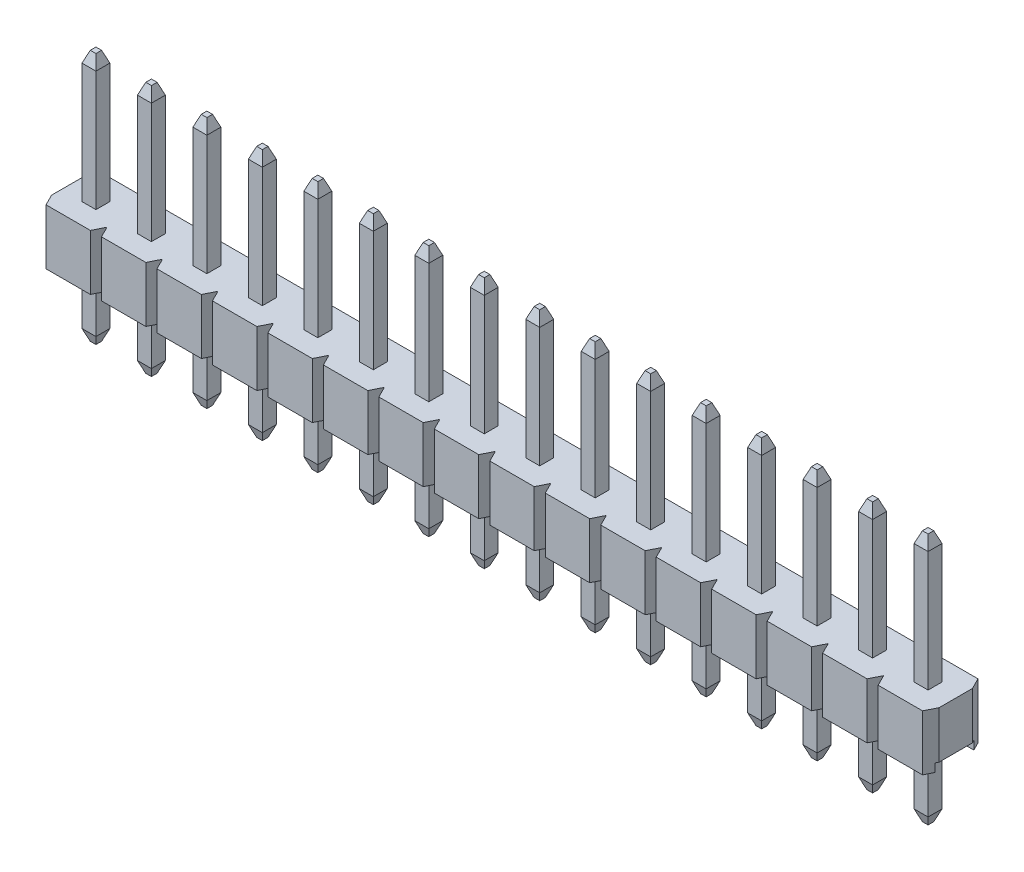
from build123d import *
from OCP.BRepFilletAPI import BRepFilletAPI_MakeChamfer

# Parameters (mm, degrees)
SKETCH1_W                     = 2.54
SKETCH1_H                     = 2.54
MAIN_BODY_DEPTH               = 2.54
SKETCH3_W                     = 1.778
SKETCH3_H                     = 0.381
CUT_EXTRUDE1_DEPTH            = 5.399409051
CUT_EXTRUDE2_DEPTH            = 5.399409051
BODY_PATTERN_COUNT            = 16
BODY_PATTERN_PITCH            = 2.54
PIN_START                     = -5.54
SKETCH2_W                     = 0.64
SKETCH2_H                     = 0.64
PIN_DEPTH                     = 11.54
CHAMFER1_SIZE                 = 0.508
CHAMFER1_SIZE2                = 0.1905
CHAMFER2_SIZE                 = 0.1905
CHAMFER2_SIZE2                = 0.508
PIN_PATTERN_COUNT             = 16
PIN_PATTERN_PITCH             = 2.54
CHAMFER1_OF_PIN_PATTERN_SIZE  = 0.508
CHAMFER1_OF_PIN_PATTERN_SIZE2 = 0.1905
CHAMFER2_OF_PIN_PATTERN_SIZE2 = 0.1905
CHAMFER2_OF_PIN_PATTERN_SIZE  = 0.508


with BuildPart() as part:
    # Sketch1 → Main Body (new body)
    with BuildSketch(Plane(origin=(0, 0, 0), x_dir=(1, 0, 0), z_dir=(0, 1, 0))):
        with Locations((1.27, 1.27)):
            Rectangle(SKETCH1_W, SKETCH1_H)
    main_body = extrude(amount=MAIN_BODY_DEPTH)

    # Sketch3 → Cut-Extrude1 (cut, through all)
    with BuildSketch(Plane.ZY):
        with Locations((-1.27, 0.1905)):
            Rectangle(SKETCH3_W, SKETCH3_H)
    cut_extrude1 = extrude(amount=-CUT_EXTRUDE1_DEPTH, mode=Mode.SUBTRACT)

    # Sketch4 → Cut-Extrude2 (cut, through all)
    with BuildSketch(Plane(origin=(0, 2.54, 0), x_dir=(1, 0, 0), z_dir=(0, 1, 0))):
        Polygon((0.254, 2.54), (0, 2.54), (0, 2.032), align=None)
        Polygon((2.54, 2.54), (2.286, 2.54), (2.54, 2.032), align=None)
        Polygon((0.254, 0), (0, 0.508), (0, 0), align=None)
        Polygon((2.54, 0), (2.286, 0), (2.54, 0.508), align=None)
    cut_extrude2 = extrude(amount=-CUT_EXTRUDE2_DEPTH, mode=Mode.SUBTRACT)

    # Body Pattern: Main Body, Cut-Extrude1, Cut-Extrude2 ×16
    with Locations(*[(-i * BODY_PATTERN_PITCH, 0, 0) for i in range(1, BODY_PATTERN_COUNT)]):
        add(main_body)
        add(cut_extrude1, mode=Mode.SUBTRACT)
        add(cut_extrude2, mode=Mode.SUBTRACT)

    # Sketch2 → Pin (add)
    with BuildSketch(Plane(origin=(0, 2.54, 0), x_dir=(1, 0, 0), z_dir=(0, 1, 0)).offset(PIN_START)):
        with Locations((1.27, 1.27)):
            Rectangle(SKETCH2_W, SKETCH2_H)
    pin = extrude(amount=PIN_DEPTH)

    # Chamfer1: one chamfer whose edges measure the first distance from different faces: ONE call of the kernel's chamfer builder (chamfer() names one face for all edges)
    chamfer1_edges_1 = [part.edges().sort_by_distance(p)[0] for p in [
        (0.95, 8.54, -1.27),
    ]]
    chamfer1_side_1 = [part.faces().sort_by_distance(p)[0] for p in [
        (0.95, 5.54, -1.27),
    ]]
    chamfer1_edges_2 = [part.edges().sort_by_distance(p)[0] for p in [
        (1.27, 8.54, -0.95),
    ]]
    chamfer1_side_2 = [part.faces().sort_by_distance(p)[0] for p in [
        (1.27, 5.54, -0.95),
    ]]
    chamfer1_edges_3 = [part.edges().sort_by_distance(p)[0] for p in [
        (1.59, 8.54, -1.27),
    ]]
    chamfer1_side_3 = [part.faces().sort_by_distance(p)[0] for p in [
        (1.59, 5.54, -1.27),
    ]]
    chamfer1_edges_4 = [part.edges().sort_by_distance(p)[0] for p in [
        (1.27, 8.54, -1.59),
    ]]
    chamfer1_side_4 = [part.faces().sort_by_distance(p)[0] for p in [
        (1.27, 5.54, -1.59),
    ]]
    chamfer1 = BRepFilletAPI_MakeChamfer(part.part.solid().wrapped)
    for e in chamfer1_edges_1:
        chamfer1.Add(CHAMFER1_SIZE, CHAMFER1_SIZE2, e.wrapped, chamfer1_side_1[0].wrapped)  # the first distance lies on this face
    for e in chamfer1_edges_2:
        chamfer1.Add(CHAMFER1_SIZE, CHAMFER1_SIZE2, e.wrapped, chamfer1_side_2[0].wrapped)  # the first distance lies on this face
    for e in chamfer1_edges_3:
        chamfer1.Add(CHAMFER1_SIZE, CHAMFER1_SIZE2, e.wrapped, chamfer1_side_3[0].wrapped)  # the first distance lies on this face
    for e in chamfer1_edges_4:
        chamfer1.Add(CHAMFER1_SIZE, CHAMFER1_SIZE2, e.wrapped, chamfer1_side_4[0].wrapped)  # the first distance lies on this face
    add(Compound.cast(chamfer1.Shape()), mode=Mode.REPLACE)

    # Chamfer2
    chamfer2_edges = [part.edges().sort_by_distance(p)[0] for p in [
        (1.27, -3, -0.95),
        (1.59, -3, -1.27),
        (1.27, -3, -1.59),
        (0.95, -3, -1.27),
    ]]
    chamfer2_side = [part.faces().sort_by_distance(p)[0] for p in [
        (1.27, -3, -1.27),
    ]]
    chamfer(chamfer2_edges, length=CHAMFER2_SIZE, length2=CHAMFER2_SIZE2, reference=chamfer2_side[0])

    # Pin Pattern: Pin ×16
    with Locations(*[(-i * PIN_PATTERN_PITCH, 0, 0) for i in range(1, PIN_PATTERN_COUNT)]):
        add(pin)

    # Chamfer1 of Pin Pattern: one chamfer whose edges measure the first distance from different faces: ONE call of the kernel's chamfer builder (chamfer() names one face for all edges)
    chamfer1_of_pin_pattern_edges_1 = [part.edges().sort_by_distance(p)[0] for p in [
        (-1.59, 8.54, -1.27),
    ]]
    chamfer1_of_pin_pattern_side_1 = [part.faces().sort_by_distance(p)[0] for p in [
        (-1.59, 5.54, -1.27),
    ]]
    chamfer1_of_pin_pattern_edges_2 = [part.edges().sort_by_distance(p)[0] for p in [
        (-1.27, 8.54, -0.95),
    ]]
    chamfer1_of_pin_pattern_side_2 = [part.faces().sort_by_distance(p)[0] for p in [
        (-1.27, 5.54, -0.95),
    ]]
    chamfer1_of_pin_pattern_edges_3 = [part.edges().sort_by_distance(p)[0] for p in [
        (-0.95, 8.54, -1.27),
    ]]
    chamfer1_of_pin_pattern_side_3 = [part.faces().sort_by_distance(p)[0] for p in [
        (-0.95, 5.54, -1.27),
    ]]
    chamfer1_of_pin_pattern_edges_4 = [part.edges().sort_by_distance(p)[0] for p in [
        (-1.27, 8.54, -1.59),
    ]]
    chamfer1_of_pin_pattern_side_4 = [part.faces().sort_by_distance(p)[0] for p in [
        (-1.27, 5.54, -1.59),
    ]]
    chamfer1_of_pin_pattern_edges_5 = [part.edges().sort_by_distance(p)[0] for p in [
        (-4.13, 8.54, -1.27),
    ]]
    chamfer1_of_pin_pattern_side_5 = [part.faces().sort_by_distance(p)[0] for p in [
        (-4.13, 5.54, -1.27),
    ]]
    chamfer1_of_pin_pattern_edges_6 = [part.edges().sort_by_distance(p)[0] for p in [
        (-3.81, 8.54, -0.95),
    ]]
    chamfer1_of_pin_pattern_side_6 = [part.faces().sort_by_distance(p)[0] for p in [
        (-3.81, 5.54, -0.95),
    ]]
    chamfer1_of_pin_pattern_edges_7 = [part.edges().sort_by_distance(p)[0] for p in [
        (-3.49, 8.54, -1.27),
    ]]
    chamfer1_of_pin_pattern_side_7 = [part.faces().sort_by_distance(p)[0] for p in [
        (-3.49, 5.54, -1.27),
    ]]
    chamfer1_of_pin_pattern_edges_8 = [part.edges().sort_by_distance(p)[0] for p in [
        (-3.81, 8.54, -1.59),
    ]]
    chamfer1_of_pin_pattern_side_8 = [part.faces().sort_by_distance(p)[0] for p in [
        (-3.81, 5.54, -1.59),
    ]]
    chamfer1_of_pin_pattern_edges_9 = [part.edges().sort_by_distance(p)[0] for p in [
        (-6.67, 8.54, -1.27),
    ]]
    chamfer1_of_pin_pattern_side_9 = [part.faces().sort_by_distance(p)[0] for p in [
        (-6.67, 5.54, -1.27),
    ]]
    chamfer1_of_pin_pattern_edges_10 = [part.edges().sort_by_distance(p)[0] for p in [
        (-6.35, 8.54, -0.95),
    ]]
    chamfer1_of_pin_pattern_side_10 = [part.faces().sort_by_distance(p)[0] for p in [
        (-6.35, 5.54, -0.95),
    ]]
    chamfer1_of_pin_pattern_edges_11 = [part.edges().sort_by_distance(p)[0] for p in [
        (-6.03, 8.54, -1.27),
    ]]
    chamfer1_of_pin_pattern_side_11 = [part.faces().sort_by_distance(p)[0] for p in [
        (-6.03, 5.54, -1.27),
    ]]
    chamfer1_of_pin_pattern_edges_12 = [part.edges().sort_by_distance(p)[0] for p in [
        (-6.35, 8.54, -1.59),
    ]]
    chamfer1_of_pin_pattern_side_12 = [part.faces().sort_by_distance(p)[0] for p in [
        (-6.35, 5.54, -1.59),
    ]]
    chamfer1_of_pin_pattern_edges_13 = [part.edges().sort_by_distance(p)[0] for p in [
        (-9.21, 8.54, -1.27),
    ]]
    chamfer1_of_pin_pattern_side_13 = [part.faces().sort_by_distance(p)[0] for p in [
        (-9.21, 5.54, -1.27),
    ]]
    chamfer1_of_pin_pattern_edges_14 = [part.edges().sort_by_distance(p)[0] for p in [
        (-8.89, 8.54, -0.95),
    ]]
    chamfer1_of_pin_pattern_side_14 = [part.faces().sort_by_distance(p)[0] for p in [
        (-8.89, 5.54, -0.95),
    ]]
    chamfer1_of_pin_pattern_edges_15 = [part.edges().sort_by_distance(p)[0] for p in [
        (-8.57, 8.54, -1.27),
    ]]
    chamfer1_of_pin_pattern_side_15 = [part.faces().sort_by_distance(p)[0] for p in [
        (-8.57, 5.54, -1.27),
    ]]
    chamfer1_of_pin_pattern_edges_16 = [part.edges().sort_by_distance(p)[0] for p in [
        (-8.89, 8.54, -1.59),
    ]]
    chamfer1_of_pin_pattern_side_16 = [part.faces().sort_by_distance(p)[0] for p in [
        (-8.89, 5.54, -1.59),
    ]]
    chamfer1_of_pin_pattern_edges_17 = [part.edges().sort_by_distance(p)[0] for p in [
        (-11.75, 8.54, -1.27),
    ]]
    chamfer1_of_pin_pattern_side_17 = [part.faces().sort_by_distance(p)[0] for p in [
        (-11.75, 5.54, -1.27),
    ]]
    chamfer1_of_pin_pattern_edges_18 = [part.edges().sort_by_distance(p)[0] for p in [
        (-11.43, 8.54, -0.95),
    ]]
    chamfer1_of_pin_pattern_side_18 = [part.faces().sort_by_distance(p)[0] for p in [
        (-11.43, 5.54, -0.95),
    ]]
    chamfer1_of_pin_pattern_edges_19 = [part.edges().sort_by_distance(p)[0] for p in [
        (-11.11, 8.54, -1.27),
    ]]
    chamfer1_of_pin_pattern_side_19 = [part.faces().sort_by_distance(p)[0] for p in [
        (-11.11, 5.54, -1.27),
    ]]
    chamfer1_of_pin_pattern_edges_20 = [part.edges().sort_by_distance(p)[0] for p in [
        (-11.43, 8.54, -1.59),
    ]]
    chamfer1_of_pin_pattern_side_20 = [part.faces().sort_by_distance(p)[0] for p in [
        (-11.43, 5.54, -1.59),
    ]]
    chamfer1_of_pin_pattern_edges_21 = [part.edges().sort_by_distance(p)[0] for p in [
        (-14.29, 8.54, -1.27),
    ]]
    chamfer1_of_pin_pattern_side_21 = [part.faces().sort_by_distance(p)[0] for p in [
        (-14.29, 5.54, -1.27),
    ]]
    chamfer1_of_pin_pattern_edges_22 = [part.edges().sort_by_distance(p)[0] for p in [
        (-13.97, 8.54, -0.95),
    ]]
    chamfer1_of_pin_pattern_side_22 = [part.faces().sort_by_distance(p)[0] for p in [
        (-13.97, 5.54, -0.95),
    ]]
    chamfer1_of_pin_pattern_edges_23 = [part.edges().sort_by_distance(p)[0] for p in [
        (-13.65, 8.54, -1.27),
    ]]
    chamfer1_of_pin_pattern_side_23 = [part.faces().sort_by_distance(p)[0] for p in [
        (-13.65, 5.54, -1.27),
    ]]
    chamfer1_of_pin_pattern_edges_24 = [part.edges().sort_by_distance(p)[0] for p in [
        (-13.97, 8.54, -1.59),
    ]]
    chamfer1_of_pin_pattern_side_24 = [part.faces().sort_by_distance(p)[0] for p in [
        (-13.97, 5.54, -1.59),
    ]]
    chamfer1_of_pin_pattern_edges_25 = [part.edges().sort_by_distance(p)[0] for p in [
        (-16.83, 8.54, -1.27),
    ]]
    chamfer1_of_pin_pattern_side_25 = [part.faces().sort_by_distance(p)[0] for p in [
        (-16.83, 5.54, -1.27),
    ]]
    chamfer1_of_pin_pattern_edges_26 = [part.edges().sort_by_distance(p)[0] for p in [
        (-16.51, 8.54, -0.95),
    ]]
    chamfer1_of_pin_pattern_side_26 = [part.faces().sort_by_distance(p)[0] for p in [
        (-16.51, 5.54, -0.95),
    ]]
    chamfer1_of_pin_pattern_edges_27 = [part.edges().sort_by_distance(p)[0] for p in [
        (-16.19, 8.54, -1.27),
    ]]
    chamfer1_of_pin_pattern_side_27 = [part.faces().sort_by_distance(p)[0] for p in [
        (-16.19, 5.54, -1.27),
    ]]
    chamfer1_of_pin_pattern_edges_28 = [part.edges().sort_by_distance(p)[0] for p in [
        (-16.51, 8.54, -1.59),
    ]]
    chamfer1_of_pin_pattern_side_28 = [part.faces().sort_by_distance(p)[0] for p in [
        (-16.51, 5.54, -1.59),
    ]]
    chamfer1_of_pin_pattern_edges_29 = [part.edges().sort_by_distance(p)[0] for p in [
        (-19.37, 8.54, -1.27),
    ]]
    chamfer1_of_pin_pattern_side_29 = [part.faces().sort_by_distance(p)[0] for p in [
        (-19.37, 5.54, -1.27),
    ]]
    chamfer1_of_pin_pattern_edges_30 = [part.edges().sort_by_distance(p)[0] for p in [
        (-19.05, 8.54, -0.95),
    ]]
    chamfer1_of_pin_pattern_side_30 = [part.faces().sort_by_distance(p)[0] for p in [
        (-19.05, 5.54, -0.95),
    ]]
    chamfer1_of_pin_pattern_edges_31 = [part.edges().sort_by_distance(p)[0] for p in [
        (-18.73, 8.54, -1.27),
    ]]
    chamfer1_of_pin_pattern_side_31 = [part.faces().sort_by_distance(p)[0] for p in [
        (-18.73, 5.54, -1.27),
    ]]
    chamfer1_of_pin_pattern_edges_32 = [part.edges().sort_by_distance(p)[0] for p in [
        (-19.05, 8.54, -1.59),
    ]]
    chamfer1_of_pin_pattern_side_32 = [part.faces().sort_by_distance(p)[0] for p in [
        (-19.05, 5.54, -1.59),
    ]]
    chamfer1_of_pin_pattern_edges_33 = [part.edges().sort_by_distance(p)[0] for p in [
        (-21.91, 8.54, -1.27),
    ]]
    chamfer1_of_pin_pattern_side_33 = [part.faces().sort_by_distance(p)[0] for p in [
        (-21.91, 5.54, -1.27),
    ]]
    chamfer1_of_pin_pattern_edges_34 = [part.edges().sort_by_distance(p)[0] for p in [
        (-21.59, 8.54, -0.95),
    ]]
    chamfer1_of_pin_pattern_side_34 = [part.faces().sort_by_distance(p)[0] for p in [
        (-21.59, 5.54, -0.95),
    ]]
    chamfer1_of_pin_pattern_edges_35 = [part.edges().sort_by_distance(p)[0] for p in [
        (-21.27, 8.54, -1.27),
    ]]
    chamfer1_of_pin_pattern_side_35 = [part.faces().sort_by_distance(p)[0] for p in [
        (-21.27, 5.54, -1.27),
    ]]
    chamfer1_of_pin_pattern_edges_36 = [part.edges().sort_by_distance(p)[0] for p in [
        (-21.59, 8.54, -1.59),
    ]]
    chamfer1_of_pin_pattern_side_36 = [part.faces().sort_by_distance(p)[0] for p in [
        (-21.59, 5.54, -1.59),
    ]]
    chamfer1_of_pin_pattern_edges_37 = [part.edges().sort_by_distance(p)[0] for p in [
        (-24.45, 8.54, -1.27),
    ]]
    chamfer1_of_pin_pattern_side_37 = [part.faces().sort_by_distance(p)[0] for p in [
        (-24.45, 5.54, -1.27),
    ]]
    chamfer1_of_pin_pattern_edges_38 = [part.edges().sort_by_distance(p)[0] for p in [
        (-24.13, 8.54, -0.95),
    ]]
    chamfer1_of_pin_pattern_side_38 = [part.faces().sort_by_distance(p)[0] for p in [
        (-24.13, 5.54, -0.95),
    ]]
    chamfer1_of_pin_pattern_edges_39 = [part.edges().sort_by_distance(p)[0] for p in [
        (-23.81, 8.54, -1.27),
    ]]
    chamfer1_of_pin_pattern_side_39 = [part.faces().sort_by_distance(p)[0] for p in [
        (-23.81, 5.54, -1.27),
    ]]
    chamfer1_of_pin_pattern_edges_40 = [part.edges().sort_by_distance(p)[0] for p in [
        (-24.13, 8.54, -1.59),
    ]]
    chamfer1_of_pin_pattern_side_40 = [part.faces().sort_by_distance(p)[0] for p in [
        (-24.13, 5.54, -1.59),
    ]]
    chamfer1_of_pin_pattern_edges_41 = [part.edges().sort_by_distance(p)[0] for p in [
        (-26.99, 8.54, -1.27),
    ]]
    chamfer1_of_pin_pattern_side_41 = [part.faces().sort_by_distance(p)[0] for p in [
        (-26.99, 5.54, -1.27),
    ]]
    chamfer1_of_pin_pattern_edges_42 = [part.edges().sort_by_distance(p)[0] for p in [
        (-26.67, 8.54, -0.95),
    ]]
    chamfer1_of_pin_pattern_side_42 = [part.faces().sort_by_distance(p)[0] for p in [
        (-26.67, 5.54, -0.95),
    ]]
    chamfer1_of_pin_pattern_edges_43 = [part.edges().sort_by_distance(p)[0] for p in [
        (-26.35, 8.54, -1.27),
    ]]
    chamfer1_of_pin_pattern_side_43 = [part.faces().sort_by_distance(p)[0] for p in [
        (-26.35, 5.54, -1.27),
    ]]
    chamfer1_of_pin_pattern_edges_44 = [part.edges().sort_by_distance(p)[0] for p in [
        (-26.67, 8.54, -1.59),
    ]]
    chamfer1_of_pin_pattern_side_44 = [part.faces().sort_by_distance(p)[0] for p in [
        (-26.67, 5.54, -1.59),
    ]]
    chamfer1_of_pin_pattern_edges_45 = [part.edges().sort_by_distance(p)[0] for p in [
        (-29.53, 8.54, -1.27),
    ]]
    chamfer1_of_pin_pattern_side_45 = [part.faces().sort_by_distance(p)[0] for p in [
        (-29.53, 5.54, -1.27),
    ]]
    chamfer1_of_pin_pattern_edges_46 = [part.edges().sort_by_distance(p)[0] for p in [
        (-29.21, 8.54, -0.95),
    ]]
    chamfer1_of_pin_pattern_side_46 = [part.faces().sort_by_distance(p)[0] for p in [
        (-29.21, 5.54, -0.95),
    ]]
    chamfer1_of_pin_pattern_edges_47 = [part.edges().sort_by_distance(p)[0] for p in [
        (-28.89, 8.54, -1.27),
    ]]
    chamfer1_of_pin_pattern_side_47 = [part.faces().sort_by_distance(p)[0] for p in [
        (-28.89, 5.54, -1.27),
    ]]
    chamfer1_of_pin_pattern_edges_48 = [part.edges().sort_by_distance(p)[0] for p in [
        (-29.21, 8.54, -1.59),
    ]]
    chamfer1_of_pin_pattern_side_48 = [part.faces().sort_by_distance(p)[0] for p in [
        (-29.21, 5.54, -1.59),
    ]]
    chamfer1_of_pin_pattern_edges_49 = [part.edges().sort_by_distance(p)[0] for p in [
        (-32.07, 8.54, -1.27),
    ]]
    chamfer1_of_pin_pattern_side_49 = [part.faces().sort_by_distance(p)[0] for p in [
        (-32.07, 5.54, -1.27),
    ]]
    chamfer1_of_pin_pattern_edges_50 = [part.edges().sort_by_distance(p)[0] for p in [
        (-31.75, 8.54, -0.95),
    ]]
    chamfer1_of_pin_pattern_side_50 = [part.faces().sort_by_distance(p)[0] for p in [
        (-31.75, 5.54, -0.95),
    ]]
    chamfer1_of_pin_pattern_edges_51 = [part.edges().sort_by_distance(p)[0] for p in [
        (-31.43, 8.54, -1.27),
    ]]
    chamfer1_of_pin_pattern_side_51 = [part.faces().sort_by_distance(p)[0] for p in [
        (-31.43, 5.54, -1.27),
    ]]
    chamfer1_of_pin_pattern_edges_52 = [part.edges().sort_by_distance(p)[0] for p in [
        (-31.75, 8.54, -1.59),
    ]]
    chamfer1_of_pin_pattern_side_52 = [part.faces().sort_by_distance(p)[0] for p in [
        (-31.75, 5.54, -1.59),
    ]]
    chamfer1_of_pin_pattern_edges_53 = [part.edges().sort_by_distance(p)[0] for p in [
        (-34.61, 8.54, -1.27),
    ]]
    chamfer1_of_pin_pattern_side_53 = [part.faces().sort_by_distance(p)[0] for p in [
        (-34.61, 5.54, -1.27),
    ]]
    chamfer1_of_pin_pattern_edges_54 = [part.edges().sort_by_distance(p)[0] for p in [
        (-34.29, 8.54, -0.95),
    ]]
    chamfer1_of_pin_pattern_side_54 = [part.faces().sort_by_distance(p)[0] for p in [
        (-34.29, 5.54, -0.95),
    ]]
    chamfer1_of_pin_pattern_edges_55 = [part.edges().sort_by_distance(p)[0] for p in [
        (-33.97, 8.54, -1.27),
    ]]
    chamfer1_of_pin_pattern_side_55 = [part.faces().sort_by_distance(p)[0] for p in [
        (-33.97, 5.54, -1.27),
    ]]
    chamfer1_of_pin_pattern_edges_56 = [part.edges().sort_by_distance(p)[0] for p in [
        (-34.29, 8.54, -1.59),
    ]]
    chamfer1_of_pin_pattern_side_56 = [part.faces().sort_by_distance(p)[0] for p in [
        (-34.29, 5.54, -1.59),
    ]]
    chamfer1_of_pin_pattern_edges_57 = [part.edges().sort_by_distance(p)[0] for p in [
        (-37.15, 8.54, -1.27),
    ]]
    chamfer1_of_pin_pattern_side_57 = [part.faces().sort_by_distance(p)[0] for p in [
        (-37.15, 5.54, -1.27),
    ]]
    chamfer1_of_pin_pattern_edges_58 = [part.edges().sort_by_distance(p)[0] for p in [
        (-36.83, 8.54, -0.95),
    ]]
    chamfer1_of_pin_pattern_side_58 = [part.faces().sort_by_distance(p)[0] for p in [
        (-36.83, 5.54, -0.95),
    ]]
    chamfer1_of_pin_pattern_edges_59 = [part.edges().sort_by_distance(p)[0] for p in [
        (-36.51, 8.54, -1.27),
    ]]
    chamfer1_of_pin_pattern_side_59 = [part.faces().sort_by_distance(p)[0] for p in [
        (-36.51, 5.54, -1.27),
    ]]
    chamfer1_of_pin_pattern_edges_60 = [part.edges().sort_by_distance(p)[0] for p in [
        (-36.83, 8.54, -1.59),
    ]]
    chamfer1_of_pin_pattern_side_60 = [part.faces().sort_by_distance(p)[0] for p in [
        (-36.83, 5.54, -1.59),
    ]]
    chamfer1_of_pin_pattern = BRepFilletAPI_MakeChamfer(part.part.solid().wrapped)
    for e in chamfer1_of_pin_pattern_edges_1:
        chamfer1_of_pin_pattern.Add(CHAMFER1_OF_PIN_PATTERN_SIZE, CHAMFER1_OF_PIN_PATTERN_SIZE2, e.wrapped, chamfer1_of_pin_pattern_side_1[0].wrapped)  # the first distance lies on this face
    for e in chamfer1_of_pin_pattern_edges_2:
        chamfer1_of_pin_pattern.Add(CHAMFER1_OF_PIN_PATTERN_SIZE, CHAMFER1_OF_PIN_PATTERN_SIZE2, e.wrapped, chamfer1_of_pin_pattern_side_2[0].wrapped)  # the first distance lies on this face
    for e in chamfer1_of_pin_pattern_edges_3:
        chamfer1_of_pin_pattern.Add(CHAMFER1_OF_PIN_PATTERN_SIZE, CHAMFER1_OF_PIN_PATTERN_SIZE2, e.wrapped, chamfer1_of_pin_pattern_side_3[0].wrapped)  # the first distance lies on this face
    for e in chamfer1_of_pin_pattern_edges_4:
        chamfer1_of_pin_pattern.Add(CHAMFER1_OF_PIN_PATTERN_SIZE, CHAMFER1_OF_PIN_PATTERN_SIZE2, e.wrapped, chamfer1_of_pin_pattern_side_4[0].wrapped)  # the first distance lies on this face
    for e in chamfer1_of_pin_pattern_edges_5:
        chamfer1_of_pin_pattern.Add(CHAMFER1_OF_PIN_PATTERN_SIZE, CHAMFER1_OF_PIN_PATTERN_SIZE2, e.wrapped, chamfer1_of_pin_pattern_side_5[0].wrapped)  # the first distance lies on this face
    for e in chamfer1_of_pin_pattern_edges_6:
        chamfer1_of_pin_pattern.Add(CHAMFER1_OF_PIN_PATTERN_SIZE, CHAMFER1_OF_PIN_PATTERN_SIZE2, e.wrapped, chamfer1_of_pin_pattern_side_6[0].wrapped)  # the first distance lies on this face
    for e in chamfer1_of_pin_pattern_edges_7:
        chamfer1_of_pin_pattern.Add(CHAMFER1_OF_PIN_PATTERN_SIZE, CHAMFER1_OF_PIN_PATTERN_SIZE2, e.wrapped, chamfer1_of_pin_pattern_side_7[0].wrapped)  # the first distance lies on this face
    for e in chamfer1_of_pin_pattern_edges_8:
        chamfer1_of_pin_pattern.Add(CHAMFER1_OF_PIN_PATTERN_SIZE, CHAMFER1_OF_PIN_PATTERN_SIZE2, e.wrapped, chamfer1_of_pin_pattern_side_8[0].wrapped)  # the first distance lies on this face
    for e in chamfer1_of_pin_pattern_edges_9:
        chamfer1_of_pin_pattern.Add(CHAMFER1_OF_PIN_PATTERN_SIZE, CHAMFER1_OF_PIN_PATTERN_SIZE2, e.wrapped, chamfer1_of_pin_pattern_side_9[0].wrapped)  # the first distance lies on this face
    for e in chamfer1_of_pin_pattern_edges_10:
        chamfer1_of_pin_pattern.Add(CHAMFER1_OF_PIN_PATTERN_SIZE, CHAMFER1_OF_PIN_PATTERN_SIZE2, e.wrapped, chamfer1_of_pin_pattern_side_10[0].wrapped)  # the first distance lies on this face
    for e in chamfer1_of_pin_pattern_edges_11:
        chamfer1_of_pin_pattern.Add(CHAMFER1_OF_PIN_PATTERN_SIZE, CHAMFER1_OF_PIN_PATTERN_SIZE2, e.wrapped, chamfer1_of_pin_pattern_side_11[0].wrapped)  # the first distance lies on this face
    for e in chamfer1_of_pin_pattern_edges_12:
        chamfer1_of_pin_pattern.Add(CHAMFER1_OF_PIN_PATTERN_SIZE, CHAMFER1_OF_PIN_PATTERN_SIZE2, e.wrapped, chamfer1_of_pin_pattern_side_12[0].wrapped)  # the first distance lies on this face
    for e in chamfer1_of_pin_pattern_edges_13:
        chamfer1_of_pin_pattern.Add(CHAMFER1_OF_PIN_PATTERN_SIZE, CHAMFER1_OF_PIN_PATTERN_SIZE2, e.wrapped, chamfer1_of_pin_pattern_side_13[0].wrapped)  # the first distance lies on this face
    for e in chamfer1_of_pin_pattern_edges_14:
        chamfer1_of_pin_pattern.Add(CHAMFER1_OF_PIN_PATTERN_SIZE, CHAMFER1_OF_PIN_PATTERN_SIZE2, e.wrapped, chamfer1_of_pin_pattern_side_14[0].wrapped)  # the first distance lies on this face
    for e in chamfer1_of_pin_pattern_edges_15:
        chamfer1_of_pin_pattern.Add(CHAMFER1_OF_PIN_PATTERN_SIZE, CHAMFER1_OF_PIN_PATTERN_SIZE2, e.wrapped, chamfer1_of_pin_pattern_side_15[0].wrapped)  # the first distance lies on this face
    for e in chamfer1_of_pin_pattern_edges_16:
        chamfer1_of_pin_pattern.Add(CHAMFER1_OF_PIN_PATTERN_SIZE, CHAMFER1_OF_PIN_PATTERN_SIZE2, e.wrapped, chamfer1_of_pin_pattern_side_16[0].wrapped)  # the first distance lies on this face
    for e in chamfer1_of_pin_pattern_edges_17:
        chamfer1_of_pin_pattern.Add(CHAMFER1_OF_PIN_PATTERN_SIZE, CHAMFER1_OF_PIN_PATTERN_SIZE2, e.wrapped, chamfer1_of_pin_pattern_side_17[0].wrapped)  # the first distance lies on this face
    for e in chamfer1_of_pin_pattern_edges_18:
        chamfer1_of_pin_pattern.Add(CHAMFER1_OF_PIN_PATTERN_SIZE, CHAMFER1_OF_PIN_PATTERN_SIZE2, e.wrapped, chamfer1_of_pin_pattern_side_18[0].wrapped)  # the first distance lies on this face
    for e in chamfer1_of_pin_pattern_edges_19:
        chamfer1_of_pin_pattern.Add(CHAMFER1_OF_PIN_PATTERN_SIZE, CHAMFER1_OF_PIN_PATTERN_SIZE2, e.wrapped, chamfer1_of_pin_pattern_side_19[0].wrapped)  # the first distance lies on this face
    for e in chamfer1_of_pin_pattern_edges_20:
        chamfer1_of_pin_pattern.Add(CHAMFER1_OF_PIN_PATTERN_SIZE, CHAMFER1_OF_PIN_PATTERN_SIZE2, e.wrapped, chamfer1_of_pin_pattern_side_20[0].wrapped)  # the first distance lies on this face
    for e in chamfer1_of_pin_pattern_edges_21:
        chamfer1_of_pin_pattern.Add(CHAMFER1_OF_PIN_PATTERN_SIZE, CHAMFER1_OF_PIN_PATTERN_SIZE2, e.wrapped, chamfer1_of_pin_pattern_side_21[0].wrapped)  # the first distance lies on this face
    for e in chamfer1_of_pin_pattern_edges_22:
        chamfer1_of_pin_pattern.Add(CHAMFER1_OF_PIN_PATTERN_SIZE, CHAMFER1_OF_PIN_PATTERN_SIZE2, e.wrapped, chamfer1_of_pin_pattern_side_22[0].wrapped)  # the first distance lies on this face
    for e in chamfer1_of_pin_pattern_edges_23:
        chamfer1_of_pin_pattern.Add(CHAMFER1_OF_PIN_PATTERN_SIZE, CHAMFER1_OF_PIN_PATTERN_SIZE2, e.wrapped, chamfer1_of_pin_pattern_side_23[0].wrapped)  # the first distance lies on this face
    for e in chamfer1_of_pin_pattern_edges_24:
        chamfer1_of_pin_pattern.Add(CHAMFER1_OF_PIN_PATTERN_SIZE, CHAMFER1_OF_PIN_PATTERN_SIZE2, e.wrapped, chamfer1_of_pin_pattern_side_24[0].wrapped)  # the first distance lies on this face
    for e in chamfer1_of_pin_pattern_edges_25:
        chamfer1_of_pin_pattern.Add(CHAMFER1_OF_PIN_PATTERN_SIZE, CHAMFER1_OF_PIN_PATTERN_SIZE2, e.wrapped, chamfer1_of_pin_pattern_side_25[0].wrapped)  # the first distance lies on this face
    for e in chamfer1_of_pin_pattern_edges_26:
        chamfer1_of_pin_pattern.Add(CHAMFER1_OF_PIN_PATTERN_SIZE, CHAMFER1_OF_PIN_PATTERN_SIZE2, e.wrapped, chamfer1_of_pin_pattern_side_26[0].wrapped)  # the first distance lies on this face
    for e in chamfer1_of_pin_pattern_edges_27:
        chamfer1_of_pin_pattern.Add(CHAMFER1_OF_PIN_PATTERN_SIZE, CHAMFER1_OF_PIN_PATTERN_SIZE2, e.wrapped, chamfer1_of_pin_pattern_side_27[0].wrapped)  # the first distance lies on this face
    for e in chamfer1_of_pin_pattern_edges_28:
        chamfer1_of_pin_pattern.Add(CHAMFER1_OF_PIN_PATTERN_SIZE, CHAMFER1_OF_PIN_PATTERN_SIZE2, e.wrapped, chamfer1_of_pin_pattern_side_28[0].wrapped)  # the first distance lies on this face
    for e in chamfer1_of_pin_pattern_edges_29:
        chamfer1_of_pin_pattern.Add(CHAMFER1_OF_PIN_PATTERN_SIZE, CHAMFER1_OF_PIN_PATTERN_SIZE2, e.wrapped, chamfer1_of_pin_pattern_side_29[0].wrapped)  # the first distance lies on this face
    for e in chamfer1_of_pin_pattern_edges_30:
        chamfer1_of_pin_pattern.Add(CHAMFER1_OF_PIN_PATTERN_SIZE, CHAMFER1_OF_PIN_PATTERN_SIZE2, e.wrapped, chamfer1_of_pin_pattern_side_30[0].wrapped)  # the first distance lies on this face
    for e in chamfer1_of_pin_pattern_edges_31:
        chamfer1_of_pin_pattern.Add(CHAMFER1_OF_PIN_PATTERN_SIZE, CHAMFER1_OF_PIN_PATTERN_SIZE2, e.wrapped, chamfer1_of_pin_pattern_side_31[0].wrapped)  # the first distance lies on this face
    for e in chamfer1_of_pin_pattern_edges_32:
        chamfer1_of_pin_pattern.Add(CHAMFER1_OF_PIN_PATTERN_SIZE, CHAMFER1_OF_PIN_PATTERN_SIZE2, e.wrapped, chamfer1_of_pin_pattern_side_32[0].wrapped)  # the first distance lies on this face
    for e in chamfer1_of_pin_pattern_edges_33:
        chamfer1_of_pin_pattern.Add(CHAMFER1_OF_PIN_PATTERN_SIZE, CHAMFER1_OF_PIN_PATTERN_SIZE2, e.wrapped, chamfer1_of_pin_pattern_side_33[0].wrapped)  # the first distance lies on this face
    for e in chamfer1_of_pin_pattern_edges_34:
        chamfer1_of_pin_pattern.Add(CHAMFER1_OF_PIN_PATTERN_SIZE, CHAMFER1_OF_PIN_PATTERN_SIZE2, e.wrapped, chamfer1_of_pin_pattern_side_34[0].wrapped)  # the first distance lies on this face
    for e in chamfer1_of_pin_pattern_edges_35:
        chamfer1_of_pin_pattern.Add(CHAMFER1_OF_PIN_PATTERN_SIZE, CHAMFER1_OF_PIN_PATTERN_SIZE2, e.wrapped, chamfer1_of_pin_pattern_side_35[0].wrapped)  # the first distance lies on this face
    for e in chamfer1_of_pin_pattern_edges_36:
        chamfer1_of_pin_pattern.Add(CHAMFER1_OF_PIN_PATTERN_SIZE, CHAMFER1_OF_PIN_PATTERN_SIZE2, e.wrapped, chamfer1_of_pin_pattern_side_36[0].wrapped)  # the first distance lies on this face
    for e in chamfer1_of_pin_pattern_edges_37:
        chamfer1_of_pin_pattern.Add(CHAMFER1_OF_PIN_PATTERN_SIZE, CHAMFER1_OF_PIN_PATTERN_SIZE2, e.wrapped, chamfer1_of_pin_pattern_side_37[0].wrapped)  # the first distance lies on this face
    for e in chamfer1_of_pin_pattern_edges_38:
        chamfer1_of_pin_pattern.Add(CHAMFER1_OF_PIN_PATTERN_SIZE, CHAMFER1_OF_PIN_PATTERN_SIZE2, e.wrapped, chamfer1_of_pin_pattern_side_38[0].wrapped)  # the first distance lies on this face
    for e in chamfer1_of_pin_pattern_edges_39:
        chamfer1_of_pin_pattern.Add(CHAMFER1_OF_PIN_PATTERN_SIZE, CHAMFER1_OF_PIN_PATTERN_SIZE2, e.wrapped, chamfer1_of_pin_pattern_side_39[0].wrapped)  # the first distance lies on this face
    for e in chamfer1_of_pin_pattern_edges_40:
        chamfer1_of_pin_pattern.Add(CHAMFER1_OF_PIN_PATTERN_SIZE, CHAMFER1_OF_PIN_PATTERN_SIZE2, e.wrapped, chamfer1_of_pin_pattern_side_40[0].wrapped)  # the first distance lies on this face
    for e in chamfer1_of_pin_pattern_edges_41:
        chamfer1_of_pin_pattern.Add(CHAMFER1_OF_PIN_PATTERN_SIZE, CHAMFER1_OF_PIN_PATTERN_SIZE2, e.wrapped, chamfer1_of_pin_pattern_side_41[0].wrapped)  # the first distance lies on this face
    for e in chamfer1_of_pin_pattern_edges_42:
        chamfer1_of_pin_pattern.Add(CHAMFER1_OF_PIN_PATTERN_SIZE, CHAMFER1_OF_PIN_PATTERN_SIZE2, e.wrapped, chamfer1_of_pin_pattern_side_42[0].wrapped)  # the first distance lies on this face
    for e in chamfer1_of_pin_pattern_edges_43:
        chamfer1_of_pin_pattern.Add(CHAMFER1_OF_PIN_PATTERN_SIZE, CHAMFER1_OF_PIN_PATTERN_SIZE2, e.wrapped, chamfer1_of_pin_pattern_side_43[0].wrapped)  # the first distance lies on this face
    for e in chamfer1_of_pin_pattern_edges_44:
        chamfer1_of_pin_pattern.Add(CHAMFER1_OF_PIN_PATTERN_SIZE, CHAMFER1_OF_PIN_PATTERN_SIZE2, e.wrapped, chamfer1_of_pin_pattern_side_44[0].wrapped)  # the first distance lies on this face
    for e in chamfer1_of_pin_pattern_edges_45:
        chamfer1_of_pin_pattern.Add(CHAMFER1_OF_PIN_PATTERN_SIZE, CHAMFER1_OF_PIN_PATTERN_SIZE2, e.wrapped, chamfer1_of_pin_pattern_side_45[0].wrapped)  # the first distance lies on this face
    for e in chamfer1_of_pin_pattern_edges_46:
        chamfer1_of_pin_pattern.Add(CHAMFER1_OF_PIN_PATTERN_SIZE, CHAMFER1_OF_PIN_PATTERN_SIZE2, e.wrapped, chamfer1_of_pin_pattern_side_46[0].wrapped)  # the first distance lies on this face
    for e in chamfer1_of_pin_pattern_edges_47:
        chamfer1_of_pin_pattern.Add(CHAMFER1_OF_PIN_PATTERN_SIZE, CHAMFER1_OF_PIN_PATTERN_SIZE2, e.wrapped, chamfer1_of_pin_pattern_side_47[0].wrapped)  # the first distance lies on this face
    for e in chamfer1_of_pin_pattern_edges_48:
        chamfer1_of_pin_pattern.Add(CHAMFER1_OF_PIN_PATTERN_SIZE, CHAMFER1_OF_PIN_PATTERN_SIZE2, e.wrapped, chamfer1_of_pin_pattern_side_48[0].wrapped)  # the first distance lies on this face
    for e in chamfer1_of_pin_pattern_edges_49:
        chamfer1_of_pin_pattern.Add(CHAMFER1_OF_PIN_PATTERN_SIZE, CHAMFER1_OF_PIN_PATTERN_SIZE2, e.wrapped, chamfer1_of_pin_pattern_side_49[0].wrapped)  # the first distance lies on this face
    for e in chamfer1_of_pin_pattern_edges_50:
        chamfer1_of_pin_pattern.Add(CHAMFER1_OF_PIN_PATTERN_SIZE, CHAMFER1_OF_PIN_PATTERN_SIZE2, e.wrapped, chamfer1_of_pin_pattern_side_50[0].wrapped)  # the first distance lies on this face
    for e in chamfer1_of_pin_pattern_edges_51:
        chamfer1_of_pin_pattern.Add(CHAMFER1_OF_PIN_PATTERN_SIZE, CHAMFER1_OF_PIN_PATTERN_SIZE2, e.wrapped, chamfer1_of_pin_pattern_side_51[0].wrapped)  # the first distance lies on this face
    for e in chamfer1_of_pin_pattern_edges_52:
        chamfer1_of_pin_pattern.Add(CHAMFER1_OF_PIN_PATTERN_SIZE, CHAMFER1_OF_PIN_PATTERN_SIZE2, e.wrapped, chamfer1_of_pin_pattern_side_52[0].wrapped)  # the first distance lies on this face
    for e in chamfer1_of_pin_pattern_edges_53:
        chamfer1_of_pin_pattern.Add(CHAMFER1_OF_PIN_PATTERN_SIZE, CHAMFER1_OF_PIN_PATTERN_SIZE2, e.wrapped, chamfer1_of_pin_pattern_side_53[0].wrapped)  # the first distance lies on this face
    for e in chamfer1_of_pin_pattern_edges_54:
        chamfer1_of_pin_pattern.Add(CHAMFER1_OF_PIN_PATTERN_SIZE, CHAMFER1_OF_PIN_PATTERN_SIZE2, e.wrapped, chamfer1_of_pin_pattern_side_54[0].wrapped)  # the first distance lies on this face
    for e in chamfer1_of_pin_pattern_edges_55:
        chamfer1_of_pin_pattern.Add(CHAMFER1_OF_PIN_PATTERN_SIZE, CHAMFER1_OF_PIN_PATTERN_SIZE2, e.wrapped, chamfer1_of_pin_pattern_side_55[0].wrapped)  # the first distance lies on this face
    for e in chamfer1_of_pin_pattern_edges_56:
        chamfer1_of_pin_pattern.Add(CHAMFER1_OF_PIN_PATTERN_SIZE, CHAMFER1_OF_PIN_PATTERN_SIZE2, e.wrapped, chamfer1_of_pin_pattern_side_56[0].wrapped)  # the first distance lies on this face
    for e in chamfer1_of_pin_pattern_edges_57:
        chamfer1_of_pin_pattern.Add(CHAMFER1_OF_PIN_PATTERN_SIZE, CHAMFER1_OF_PIN_PATTERN_SIZE2, e.wrapped, chamfer1_of_pin_pattern_side_57[0].wrapped)  # the first distance lies on this face
    for e in chamfer1_of_pin_pattern_edges_58:
        chamfer1_of_pin_pattern.Add(CHAMFER1_OF_PIN_PATTERN_SIZE, CHAMFER1_OF_PIN_PATTERN_SIZE2, e.wrapped, chamfer1_of_pin_pattern_side_58[0].wrapped)  # the first distance lies on this face
    for e in chamfer1_of_pin_pattern_edges_59:
        chamfer1_of_pin_pattern.Add(CHAMFER1_OF_PIN_PATTERN_SIZE, CHAMFER1_OF_PIN_PATTERN_SIZE2, e.wrapped, chamfer1_of_pin_pattern_side_59[0].wrapped)  # the first distance lies on this face
    for e in chamfer1_of_pin_pattern_edges_60:
        chamfer1_of_pin_pattern.Add(CHAMFER1_OF_PIN_PATTERN_SIZE, CHAMFER1_OF_PIN_PATTERN_SIZE2, e.wrapped, chamfer1_of_pin_pattern_side_60[0].wrapped)  # the first distance lies on this face
    add(Compound.cast(chamfer1_of_pin_pattern.Shape()), mode=Mode.REPLACE)

    # Chamfer2 of Pin Pattern
    chamfer2_of_pin_pattern_edges = [part.edges().sort_by_distance(p)[0] for p in [
        (-1.27, -3, -0.95),
        (-0.95, -3, -1.27),
        (-1.27, -3, -1.59),
        (-1.59, -3, -1.27),
        (-3.81, -3, -0.95),
        (-3.49, -3, -1.27),
        (-3.81, -3, -1.59),
        (-4.13, -3, -1.27),
        (-6.35, -3, -0.95),
        (-6.03, -3, -1.27),
        (-6.35, -3, -1.59),
        (-6.67, -3, -1.27),
        (-8.89, -3, -0.95),
        (-8.57, -3, -1.27),
        (-8.89, -3, -1.59),
        (-9.21, -3, -1.27),
        (-11.43, -3, -0.95),
        (-11.11, -3, -1.27),
        (-11.43, -3, -1.59),
        (-11.75, -3, -1.27),
        (-13.97, -3, -0.95),
        (-13.65, -3, -1.27),
        (-13.97, -3, -1.59),
        (-14.29, -3, -1.27),
        (-16.51, -3, -0.95),
        (-16.19, -3, -1.27),
        (-16.51, -3, -1.59),
        (-16.83, -3, -1.27),
        (-19.05, -3, -0.95),
        (-18.73, -3, -1.27),
        (-19.05, -3, -1.59),
        (-19.37, -3, -1.27),
        (-21.59, -3, -0.95),
        (-21.27, -3, -1.27),
        (-21.59, -3, -1.59),
        (-21.91, -3, -1.27),
        (-24.13, -3, -0.95),
        (-23.81, -3, -1.27),
        (-24.13, -3, -1.59),
        (-24.45, -3, -1.27),
        (-26.67, -3, -0.95),
        (-26.35, -3, -1.27),
        (-26.67, -3, -1.59),
        (-26.99, -3, -1.27),
        (-29.21, -3, -0.95),
        (-28.89, -3, -1.27),
        (-29.21, -3, -1.59),
        (-29.53, -3, -1.27),
        (-31.75, -3, -0.95),
        (-31.43, -3, -1.27),
        (-31.75, -3, -1.59),
        (-32.07, -3, -1.27),
        (-34.29, -3, -0.95),
        (-33.97, -3, -1.27),
        (-34.29, -3, -1.59),
        (-34.61, -3, -1.27),
        (-36.83, -3, -0.95),
        (-36.51, -3, -1.27),
        (-36.83, -3, -1.59),
        (-37.15, -3, -1.27),
    ]]
    chamfer(chamfer2_of_pin_pattern_edges, length=CHAMFER2_OF_PIN_PATTERN_SIZE, length2=CHAMFER2_OF_PIN_PATTERN_SIZE2)


solid = part.part
